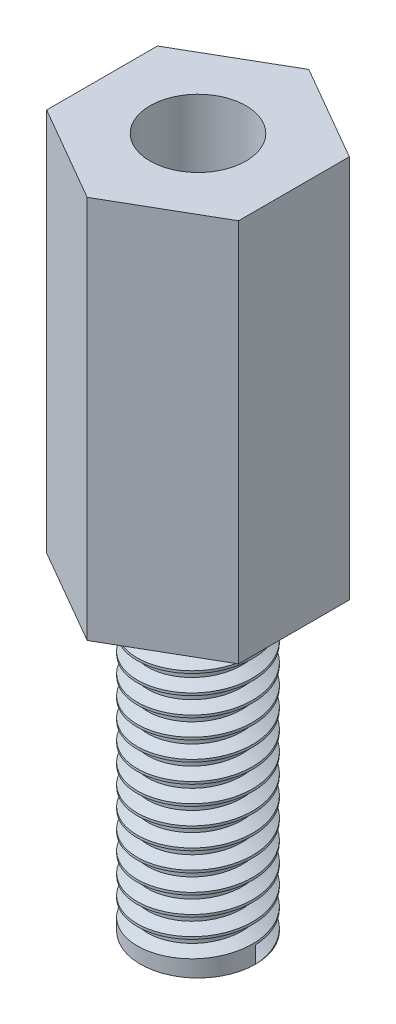
from build123d import *

# Parameters (mm, degrees)
CUT_EXTRUDE2_DEPTH      = 20.339079606
CUT_EXTRUDE2_DEPTH_BACK = 20.339079606
SKETCH2_OUTSIDE_W       = 16.578
SKETCH2_OUTSIDE_H       = 16.578
THREAD1_PITCH           = 0.5
M3_TAPPED_HOLE1_D       = 2.5
M3_TAPPED_HOLE1_DEPTH   = 9.5
M3_TAPPED_HOLE1_TIP     = 0.751075774


with BuildPart() as part:
    # Sketch1 → Revolve1 (revolve)
    with BuildSketch(Plane.XY, mode=Mode.PRIVATE) as revolve1_sk:
        Polygon((0, 0), (0, 18), (5, 18), (5, 8), (1.5, 8), (1.5, 0), align=None)
    revolve(revolve1_sk.sketch.rotate(Axis((0, 0, 0), (0, 1, 0)), 90), axis=Axis((0, 0, 0), (0, 1, 0)))

    # Sketch2 outside → Cut-Extrude2 (cut, two sides: drawn at the far end of the back side and taken through both)
    with BuildSketch(Plane(origin=(0, 0, 0), x_dir=(1, 0, 0), z_dir=(0, 1, 0)).offset(-CUT_EXTRUDE2_DEPTH_BACK)):
        Rectangle(SKETCH2_OUTSIDE_W, SKETCH2_OUTSIDE_H)
        Polygon((0, -2.886751346), (-2.5, -1.443375673), (-2.5, 1.443375673), (0, 2.886751346), (2.5, 1.443375673), (2.5, -1.443375673), align=None, mode=Mode.SUBTRACT)
    extrude(amount=CUT_EXTRUDE2_DEPTH + CUT_EXTRUDE2_DEPTH_BACK, mode=Mode.SUBTRACT)

    # Thread1: the profile of Thread Profile1 profile screwed along a right-hand helix of 16 turns, 6 arcs to a turn; built about Z, then put on its axis
    thread1_z = Axis((0, 0, 0), (0, 0, 1))
    thread1_corners = [(1.5003, 0, -0.000173205), (1.5003, 0, 0.437673204), (1.229367063, 0, 0.281249999), (1.229367063, 0, 0.156249999)]
    with BuildLine(mode=Mode.PRIVATE) as thread1_profile:
        Line(thread1_corners[0], thread1_corners[1])
        Line(thread1_corners[1], thread1_corners[2])
        Line(thread1_corners[2], thread1_corners[3])
        Line(thread1_corners[3], thread1_corners[0])
    thread1_cap = Face(thread1_profile.wire())
    thread1_turn_angles = [0, 30, 60, 90, 120, 150, 180, 210, 240, 270, 300, 330, 360]
    thread1_turn_weights = [1, 0.8660254037844387, 1, 0.8660254037844387, 1, 0.8660254037844387, 1, 0.8660254037844387, 1, 0.8660254037844387, 1, 0.8660254037844387, 1]
    thread1_turn_rails = [Edge.make_bspline([Vector(p[0], p[1], 0).rotate(thread1_z, thread1_turn_angles[k]) / thread1_turn_weights[k] + Vector(0, 0, p[2] + THREAD1_PITCH * thread1_turn_angles[k] / 360) for k in range(13)], [0, 0, 0, 1, 1, 2, 2, 3, 3, 4, 4, 5, 5, 6, 6, 6], 2, thread1_turn_weights) for p in thread1_corners]
    thread1_turn_sides = [Face.make_surface_from_curves(thread1_turn_rails[p[0]], thread1_turn_rails[p[1]]) for p in [(0, 1), (1, 2), (2, 3), (3, 0)]]
    thread1 = Plane(origin=(0, 0, 0), x_dir=(1, 0, 0), z_dir=(0, 1, 0)) * Solid(Shell([*[p.moved(Location((0, 0, THREAD1_PITCH * i))) for i in range(16) for p in thread1_turn_sides], thread1_cap, thread1_cap.rotate(thread1_z, 5760).moved(Location((0, 0, THREAD1_PITCH * 5760 / 360)))]))
    add(thread1, mode=Mode.SUBTRACT)

    # M3 Tapped Hole1
    with Locations(Plane(origin=(0, 18, 18), x_dir=(1, 0, 0), z_dir=(0, 1, 0))):
        with Locations((0, 18)):
            Hole(M3_TAPPED_HOLE1_D / 2, depth=M3_TAPPED_HOLE1_DEPTH)
            with Locations((0, 0, -(M3_TAPPED_HOLE1_DEPTH + M3_TAPPED_HOLE1_TIP / 2))):  # 118° drill point
                Cone(0, M3_TAPPED_HOLE1_D / 2, M3_TAPPED_HOLE1_TIP, mode=Mode.SUBTRACT)


solid = part.part
